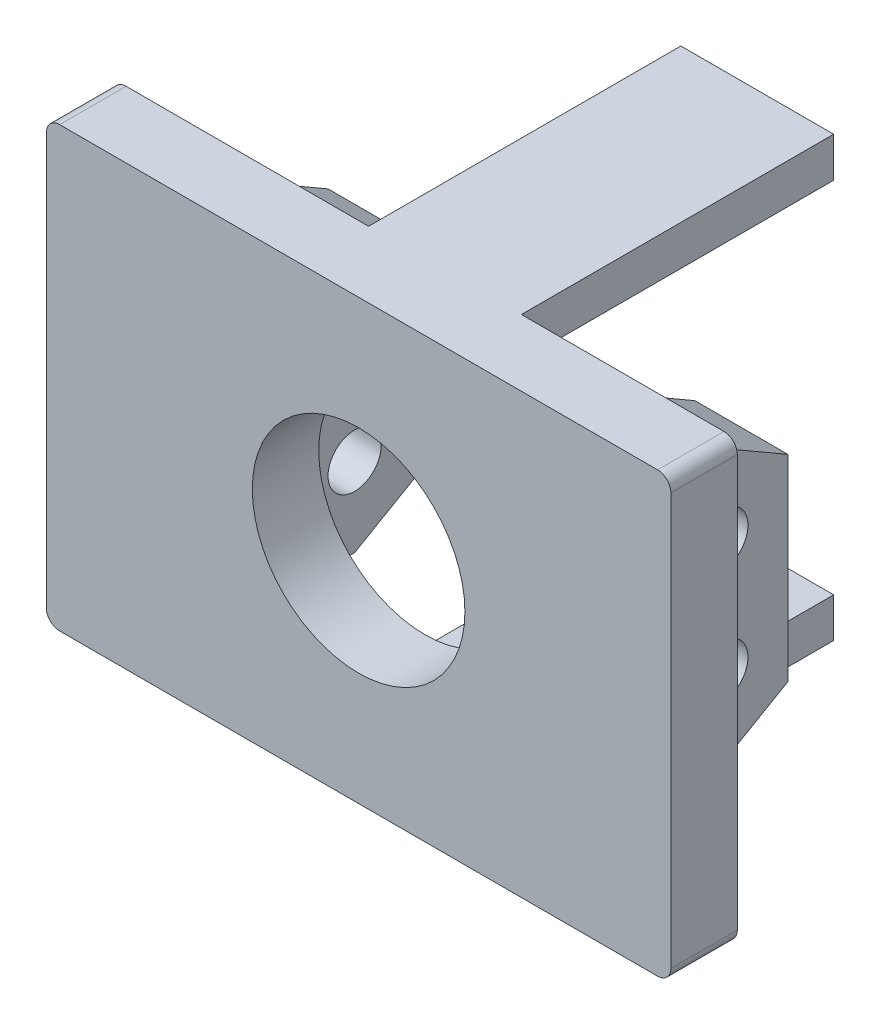
from build123d import *
from OCP.BRepFilletAPI import BRepFilletAPI_MakeChamfer

# Parameters (mm, degrees)
SZKIC1_W                    = 47
SZKIC1_H                    = 33
SZKIC1_R                    = 8
DODANIE_WYCI_GNI_CIE1_DEPTH = 5
SZKIC2_W                    = 7
SZKIC2_H                    = 20.6
DODANIE_WYCI_GNI_CIE2_DEPTH = 10
SFAZOWANIE1_SIZE            = 5
SFAZOWANIE1_SIZE2           = 2.886751346
SZKIC3_R                    = 2
WYTNIJ_WYCI_GNI_CIE1_DEPTH  = 46.131917752
ZAOKR_GLENIE1_R             = 1
SZKIC4_W                    = 11.5
SZKIC4_H                    = 3
SZKIC4_W_2                  = 12
SZKIC4_H_2                  = 2.980259267
DODANIE_WYCI_GNI_CIE3_DEPTH = 23.5


with BuildPart() as part:
    # Szkic1 → Dodanie-wyciągnięcie1 (new body)
    with BuildSketch(Plane.XY):
        Rectangle(SZKIC1_W, SZKIC1_H)
        Circle(SZKIC1_R, mode=Mode.SUBTRACT)
    extrude(amount=DODANIE_WYCI_GNI_CIE1_DEPTH)

    # Szkic2 → Dodanie-wyciągnięcie2 (add)
    with BuildSketch(Plane(origin=(0, 0, 0), x_dir=(-1, 0, 0), z_dir=(0, 0, -1))):
        with Locations((-13.8, 0)):
            Rectangle(SZKIC2_W, SZKIC2_H)
        with Locations((13.8, 0)):
            Rectangle(SZKIC2_W, SZKIC2_H)
    extrude(amount=DODANIE_WYCI_GNI_CIE2_DEPTH)

    # Sfazowanie1: one chamfer whose edges measure the first distance from different faces: ONE call of the kernel's chamfer builder (chamfer() names one face for all edges)
    sfazowanie1_edges_1 = [part.edges().sort_by_distance(p)[0] for p in [
        (13.8, 10.3, -10),
    ]]
    sfazowanie1_side_1 = [part.faces().sort_by_distance(p)[0] for p in [
        (13.8, 10.3, -5),
    ]]
    sfazowanie1_edges_2 = [part.edges().sort_by_distance(p)[0] for p in [
        (-13.8, 10.3, -10),
    ]]
    sfazowanie1_side_2 = [part.faces().sort_by_distance(p)[0] for p in [
        (-13.8, 10.3, -5),
    ]]
    sfazowanie1_edges_3 = [part.edges().sort_by_distance(p)[0] for p in [
        (-13.8, -10.3, -10),
    ]]
    sfazowanie1_side_3 = [part.faces().sort_by_distance(p)[0] for p in [
        (-13.8, -10.3, -5),
    ]]
    sfazowanie1_edges_4 = [part.edges().sort_by_distance(p)[0] for p in [
        (13.8, -10.3, -10),
    ]]
    sfazowanie1_side_4 = [part.faces().sort_by_distance(p)[0] for p in [
        (13.8, -10.3, -5),
    ]]
    sfazowanie1 = BRepFilletAPI_MakeChamfer(part.part.solid().wrapped)
    for e in sfazowanie1_edges_1:
        sfazowanie1.Add(SFAZOWANIE1_SIZE, SFAZOWANIE1_SIZE2, e.wrapped, sfazowanie1_side_1[0].wrapped)  # the first distance lies on this face
    for e in sfazowanie1_edges_2:
        sfazowanie1.Add(SFAZOWANIE1_SIZE, SFAZOWANIE1_SIZE2, e.wrapped, sfazowanie1_side_2[0].wrapped)  # the first distance lies on this face
    for e in sfazowanie1_edges_3:
        sfazowanie1.Add(SFAZOWANIE1_SIZE, SFAZOWANIE1_SIZE2, e.wrapped, sfazowanie1_side_3[0].wrapped)  # the first distance lies on this face
    for e in sfazowanie1_edges_4:
        sfazowanie1.Add(SFAZOWANIE1_SIZE, SFAZOWANIE1_SIZE2, e.wrapped, sfazowanie1_side_4[0].wrapped)  # the first distance lies on this face
    add(Compound.cast(sfazowanie1.Shape()), mode=Mode.REPLACE)

    # Szkic3 → Wytnij-wyciągnięcie1 (cut, through all)
    with BuildSketch(Plane(origin=(17.3, 0, 0), x_dir=(0, 0, -1), z_dir=(1, 0, 0))):
        with Locations((5, 4.3)):
            Circle(SZKIC3_R)
        with Locations((5, -4.3)):
            Circle(SZKIC3_R)
    extrude(amount=-WYTNIJ_WYCI_GNI_CIE1_DEPTH, mode=Mode.SUBTRACT)

    # Zaokrąglenie1
    zaokr_glenie1_edges = [part.edges().sort_by_distance(p)[0] for p in [
        (-23.5, -16.5, 2.5),
        (23.5, -16.5, 2.5),
        (-23.5, 16.5, 2.5),
        (23.5, 16.5, 2.5),
    ]]
    fillet(zaokr_glenie1_edges, radius=ZAOKR_GLENIE1_R)

    # Szkic4 → Dodanie-wyciągnięcie3 (add)
    with BuildSketch(Plane(origin=(0, 0, 0), x_dir=(-1, 0, 0), z_dir=(0, 0, -1))):
        with Locations((-1.5, 15)):
            Rectangle(SZKIC4_W, SZKIC4_H)
        with Locations((-1.25, -15.009870366)):
            Rectangle(SZKIC4_W_2, SZKIC4_H_2)
    extrude(amount=DODANIE_WYCI_GNI_CIE3_DEPTH)


solid = part.part
